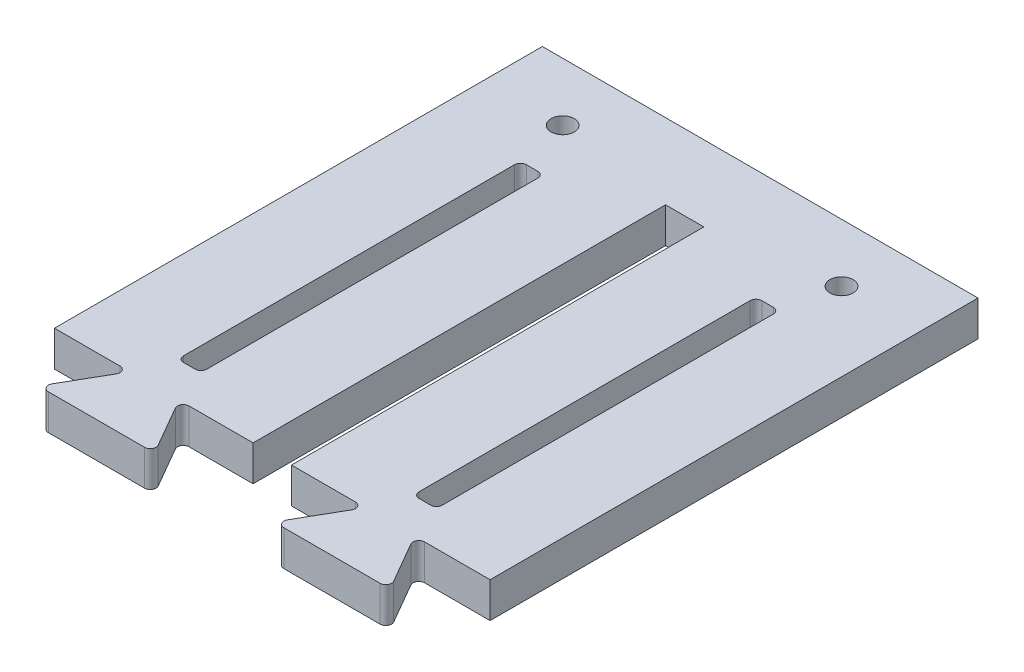
from build123d import *

# Parameters (mm, degrees)
BOSS_EXTRUDE1_DEPTH      = 3.05
FILLET1_R                = 0.5
SKETCH3_W                = 3.3
SKETCH3_H                = 40
SKETCH3_H_2              = 1
CUT_EXTRUDE2_DEPTH       = 47.30188981
SKETCH8_W                = 2
SKETCH8_H                = 29.5
CUT_EXTRUDE3_DEPTH       = 47.30188981
FILLET2_R                = 0.5
M3_TAPPED_DAMPER_HOLES_D = 2
SKETCH9_W                = 0.5
SKETCH9_H                = 42
CUT_EXTRUDE4_DEPTH       = 47.30188981


with BuildPart() as part:
    # Sketch1 → Boss-Extrude1 (new body)
    with BuildSketch(Plane(origin=(0, 0, 0), x_dir=(1, 0, 0), z_dir=(0, 1, 0))):
        Polygon((-19.25, 0), (-19.25, 42), (19.25, 42), (19.25, 0), (12.25, 0), (15.136751346, -5), (5.136751346, -5), (8.023502692, 0), (-8.023502692, 0), (-5.136751346, -5), (-15.136751346, -5), (-12.25, 0), align=None)
    extrude(amount=BOSS_EXTRUDE1_DEPTH)

    # Fillet1
    fillet1_edges = [part.edges().sort_by_distance(p)[0] for p in [
        (12.25, 1.525, 0),
        (15.136751346, 1.525, 5),
        (5.136751346, 1.525, 5),
        (8.023502692, 1.525, 0),
        (-8.023502692, 1.525, 0),
        (-5.136751346, 1.525, 5),
        (-15.136751346, 1.525, 5),
        (-12.25, 1.525, 0),
    ]]
    fillet(fillet1_edges, radius=FILLET1_R)

    # Sketch3 → Cut-Extrude2 (cut, through all)
    with BuildSketch(Plane(origin=(0, 3.05, 0), x_dir=(1, 0, 0), z_dir=(0, 1, 0))):
        with Locations((0, 15.5)):
            Rectangle(SKETCH3_W, SKETCH3_H)
        with Locations((0, -6.2)):
            Rectangle(SKETCH3_W, SKETCH3_H_2)
    extrude(amount=-CUT_EXTRUDE2_DEPTH, mode=Mode.SUBTRACT)

    # Sketch8 → Cut-Extrude3 (cut, through all)
    with BuildSketch(Plane(origin=(0, 3.05, 0), x_dir=(1, 0, 0), z_dir=(0, 1, 0))):
        with Locations((-10.136751346, 17.75)):
            Rectangle(SKETCH8_W, SKETCH8_H)
        with Locations((10.136751346, 17.75)):
            Rectangle(SKETCH8_W, SKETCH8_H)
    extrude(amount=-CUT_EXTRUDE3_DEPTH, mode=Mode.SUBTRACT)

    # Fillet2
    fillet2_edges = [part.edges().sort_by_distance(p)[0] for p in [
        (11.136751346, 1.525, -3),
        (9.136751346, 1.525, -3),
        (11.136751346, 1.525, -32.5),
        (9.136751346, 1.525, -32.5),
        (-9.136751346, 1.525, -3),
        (-9.136751346, 1.525, -32.5),
        (-11.136751346, 1.525, -32.5),
        (-11.136751346, 1.525, -3),
    ]]
    fillet(fillet2_edges, radius=FILLET2_R)

    # M3 Tapped Damper Holes (through all)
    with Locations(Plane(origin=(0, 3.05, 0), x_dir=(1, 0, 0), z_dir=(0, 1, 0))):
        with Locations((-12, 37), (12, 37)):
            Hole(M3_TAPPED_DAMPER_HOLES_D / 2)

    # Sketch9 → Cut-Extrude4 (cut, through all)
    with BuildSketch(Plane(origin=(0, 3.05, 0), x_dir=(1, 0, 0), z_dir=(0, 1, 0))):
        with Locations((-19, 21)):
            Rectangle(SKETCH9_W, SKETCH9_H)
        with Locations((19, 21)):
            Rectangle(SKETCH9_W, SKETCH9_H)
    extrude(amount=-CUT_EXTRUDE4_DEPTH, mode=Mode.SUBTRACT)


solid = part.part
